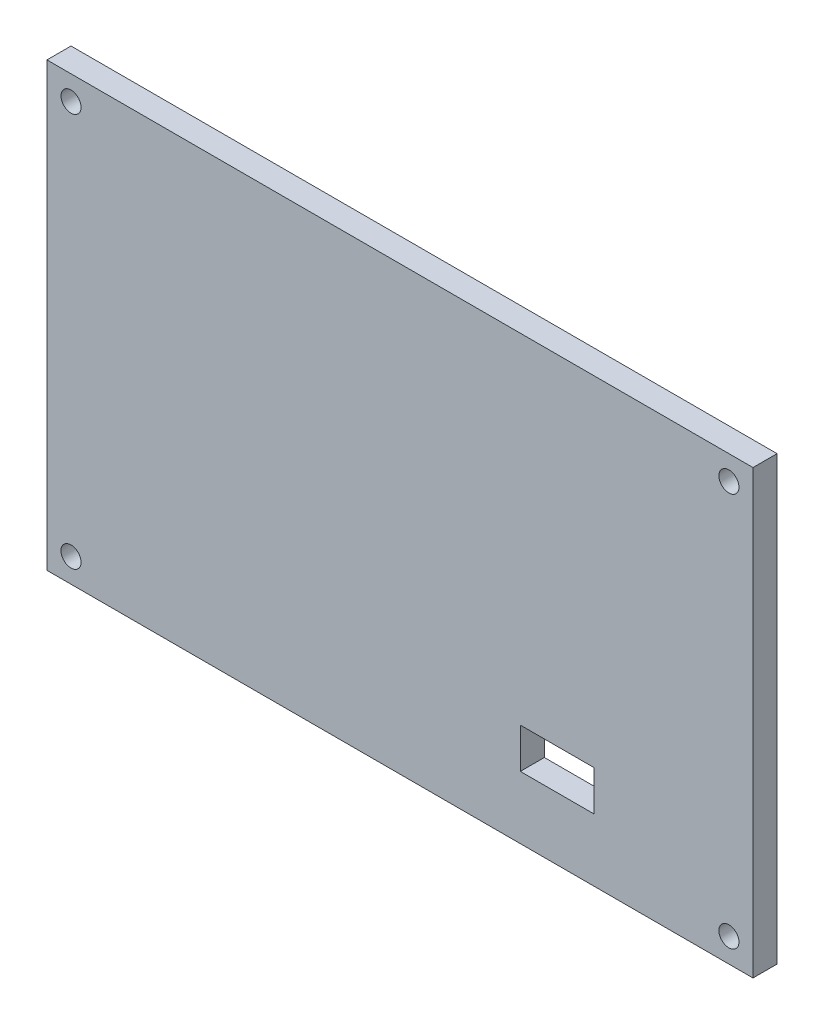
from build123d import *

# Parameters (mm, degrees)
SKETCH_1_W          = 88
SKETCH_1_H          = 55.1
EXTRUDE_1_DEPTH     = 3
SKETCH_2_R          = 1.25
CUT_EXTRUDE_1_DEPTH = 93.260514306
SKETCH_2_3_R        = 2
CUT_EXTRUDE_2_DEPTH = 1
SKETCH_3_W          = 9.2
SKETCH_3_H          = 5
CUT_EXTRUDE_3_DEPTH = 93.260514306


with BuildPart() as part:
    # 草图1 → 凸台-拉伸1 (new body)
    with BuildSketch(Plane.XY):
        with Locations((-44, 0)):
            Rectangle(SKETCH_1_W, SKETCH_1_H)
    extrude(amount=EXTRUDE_1_DEPTH)

    # 草图2 → 切除-拉伸1 (cut, through all)
    with BuildSketch(Plane(origin=(0, 0, 0), x_dir=(-1, 0, 0), z_dir=(0, 0, -1))):
        with Locations((3, 24.55)):
            Circle(SKETCH_2_R)
        with Locations((3, -24.55)):
            Circle(SKETCH_2_R)
        with Locations((85, -24.55)):
            Circle(SKETCH_2_R)
        with Locations((85, 24.55)):
            Circle(SKETCH_2_R)
    extrude(amount=-CUT_EXTRUDE_1_DEPTH, mode=Mode.SUBTRACT)

    # 草图2<3> → 切除-拉伸2 (cut)
    with BuildSketch(Plane(origin=(0, 0, 0), x_dir=(-1, 0, 0), z_dir=(0, 0, -1))):
        with Locations((3, 24.55)):
            Circle(SKETCH_2_3_R)
        with Locations((85, 24.55)):
            Circle(SKETCH_2_3_R)
        with Locations((3, -24.55)):
            Circle(SKETCH_2_3_R)
        with Locations((85, -24.55)):
            Circle(SKETCH_2_3_R)
    extrude(amount=-CUT_EXTRUDE_2_DEPTH, mode=Mode.SUBTRACT)

    # 草图3 → 切除-拉伸3 (cut, through all)
    with BuildSketch(Plane(origin=(0, 0, 0), x_dir=(-1, 0, 0), z_dir=(0, 0, -1))):
        with Locations((24.4, -17.25)):
            Rectangle(SKETCH_3_W, SKETCH_3_H)
    extrude(amount=-CUT_EXTRUDE_3_DEPTH, mode=Mode.SUBTRACT)


solid = part.part
